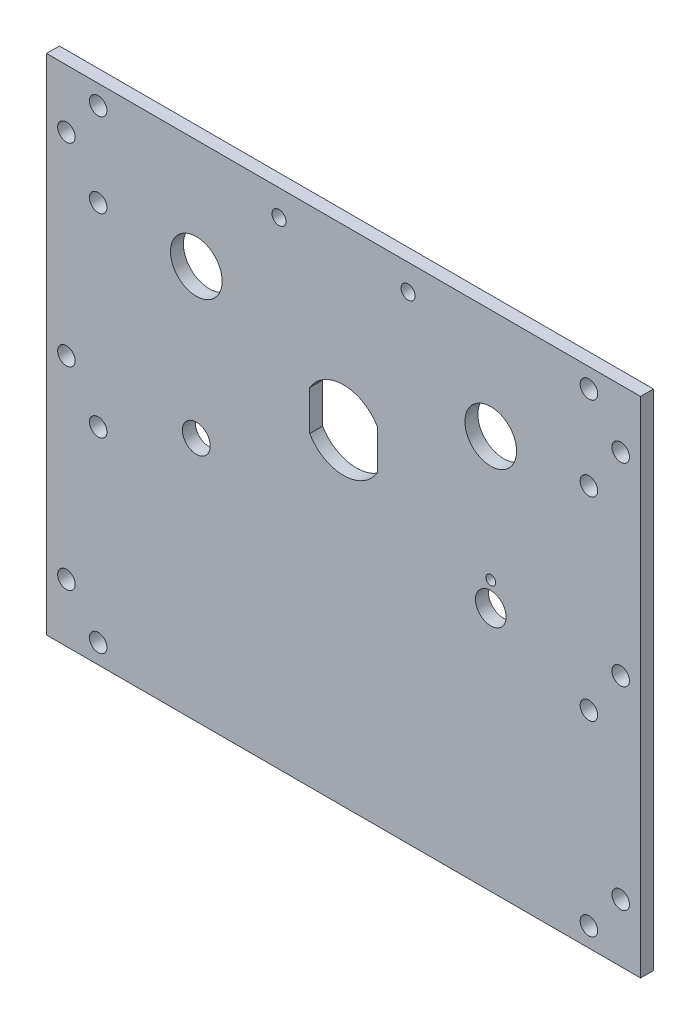
from build123d import *

# Parameters (mm, degrees)
SKETCH1_W             = 146.05
SKETCH1_H             = 123.825
BOSS_EXTRUDE1_DEPTH   = 3.175
F_6_CLEARANCE_HOLE1_D = 4.3053
SKETCH4_R             = 6.35
SKETCH4_R_2           = 3.7703125
SKETCH4_R_3           = 3.429
SKETCH4_R_4           = 1.190625
CUT_EXTRUDE1_DEPTH    = 192.502777395
F_4_CLEARANCE_HOLE1_D = 3.4544


with BuildPart() as part:
    # Sketch1 → Boss-Extrude1 (new body)
    with BuildSketch(Plane.XY):
        with Locations((-73.025, 61.9125)):
            Rectangle(SKETCH1_W, SKETCH1_H)
    extrude(amount=-BOSS_EXTRUDE1_DEPTH)

    # #6 Clearance Hole1 (through all)
    with Locations(Plane(origin=(0, 0, -3.175), x_dir=(-1, 0, 0), z_dir=(0, 0, -1))):
        with Locations((12.7, 119.0625), (133.35, 119.0625), (141.1605, 109.5375), (133.35, 98.425), (141.1605, 61.9125), (133.35, 50.673), (133.35, 4.7625), (12.7, 4.7625), (12.7, 50.673), (12.7, 98.425), (4.8895, 109.5375), (141.1605, 14.2875), (4.8895, 14.2875), (4.8895, 61.9125)):
            Hole(F_6_CLEARANCE_HOLE1_D / 2)

    # Sketch4 → Cut-Extrude1 (cut, through all)
    with BuildSketch(Plane(origin=(0, 0, -3.175), x_dir=(-1, 0, 0), z_dir=(0, 0, -1))):
        with Locations((36.83, 96.901)):
            Circle(SKETCH4_R)
        with Locations((36.83, 60.325)):
            Circle(SKETCH4_R_2)
        with Locations((109.22, 60.325)):
            Circle(SKETCH4_R_3)
        with Locations((109.22, 96.901)):
            Circle(SKETCH4_R)
        with Locations((36.830000026, 66.325)):
            Circle(SKETCH4_R_4)
        with BuildLine():
            Line((81.3435, 85.032269324), (81.3435, 75.241730676))
            ThreePointArc((81.3435, 75.241730676), (73.025, 70.485), (64.7065, 75.241730676))
            Line((64.7065, 75.241730676), (64.7065, 85.032269324))
            ThreePointArc((64.7065, 85.032269324), (73.025, 89.789), (81.3435, 85.032269324))
        make_face()
    extrude(amount=-CUT_EXTRUDE1_DEPTH, mode=Mode.SUBTRACT)

    # #4 Clearance Hole1 (through all)
    with Locations(Plane.XY):
        with Locations((-88.9, 117.475), (-57.15, 117.475)):
            Hole(F_4_CLEARANCE_HOLE1_D / 2)


solid = part.part
